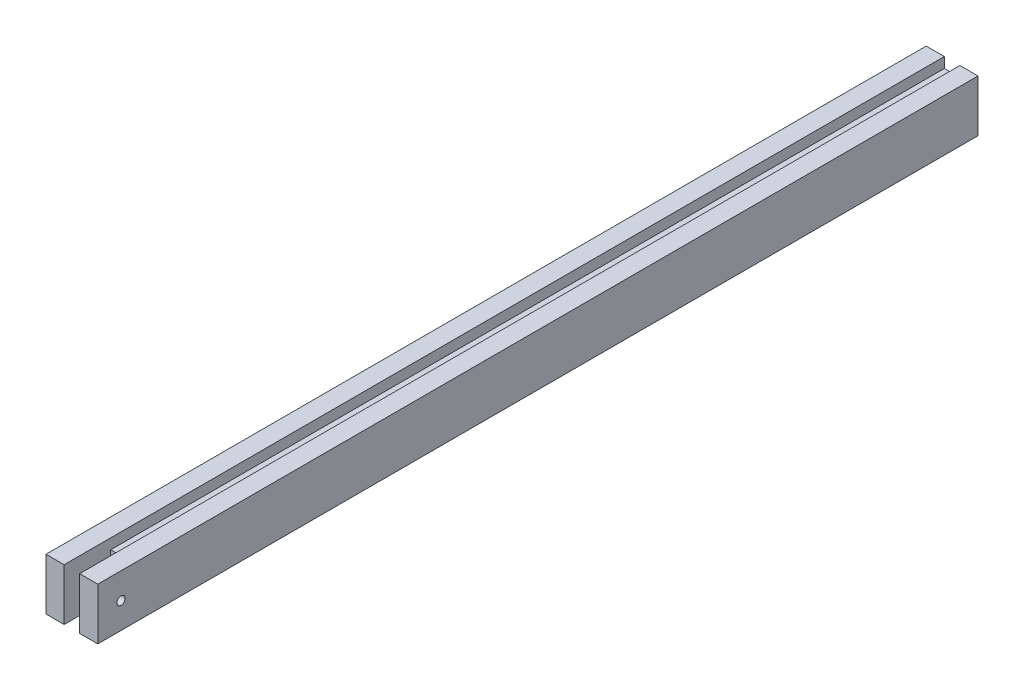
from build123d import *

# Parameters (mm, degrees)
ESQUISSE1_W             = 100
ESQUISSE1_H             = 100
BOSS_EXTRU_1_DEPTH      = 1700
ESQUISSE2_W             = 30
ESQUISSE2_H             = 90
ENL_V_MAT_EXTRU_1_DEPTH = 1706.872210923
ESQUISSE3_R             = 8
ENL_V_MAT_EXTRU_2_DEPTH = 1706.872210923
ESQUISSE4_W             = 30
ESQUISSE4_H             = 20
ENL_V_MAT_EXTRU_3_DEPTH = 1706.872210923


with BuildPart() as part:
    # Esquisse1 → Boss.-Extru.1 (new body)
    with BuildSketch(Plane.XY):
        with Locations((50, 50)):
            Rectangle(ESQUISSE1_W, ESQUISSE1_H)
    extrude(amount=BOSS_EXTRU_1_DEPTH)

    # Esquisse2 → Enlèv. mat.-Extru.1 (cut, through all)
    with BuildSketch(Plane.XZ):
        with Locations((50, 1655)):
            Rectangle(ESQUISSE2_W, ESQUISSE2_H)
    extrude(amount=-ENL_V_MAT_EXTRU_1_DEPTH, mode=Mode.SUBTRACT)

    # Esquisse3 → Enlèv. mat.-Extru.2 (cut, through all)
    with BuildSketch(Plane(origin=(100, 0, 0), x_dir=(0, 0, -1), z_dir=(1, 0, 0))):
        with Locations((-1655, 50)):
            Circle(ESQUISSE3_R)
    extrude(amount=-ENL_V_MAT_EXTRU_2_DEPTH, mode=Mode.SUBTRACT)

    # Esquisse4 → Enlèv. mat.-Extru.3 (cut, through all)
    with BuildSketch(Plane(origin=(0, 0, 0), x_dir=(-1, 0, 0), z_dir=(0, 0, -1))):
        with Locations((-50, 90)):
            Rectangle(ESQUISSE4_W, ESQUISSE4_H)
        with Locations((-50, 10)):
            Rectangle(ESQUISSE4_W, ESQUISSE4_H)
    extrude(amount=-ENL_V_MAT_EXTRU_3_DEPTH, mode=Mode.SUBTRACT)


solid = part.part
